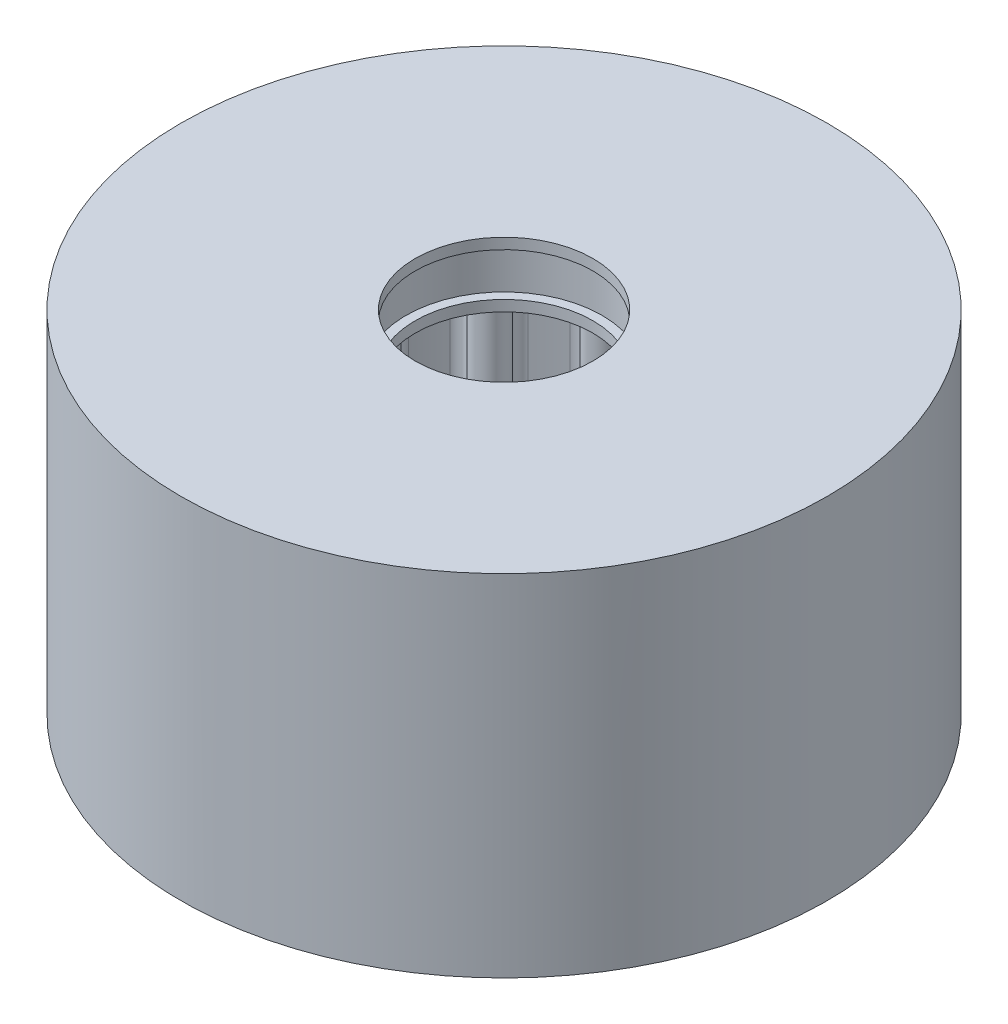
from build123d import *

# Parameters (mm, degrees)
BOSS_EXTRUDE1_DEPTH = 13.25
CIRPATTERN1_COUNT   = 21
BOSS_EXTRUDE2_START = 6
SKETCH2_R           = 30.000000000000004
SKETCH2_R_2         = 8.25
BOSS_EXTRUDE2_DEPTH = 6
SKETCH3_R           = 9.1
CUT_EXTRUDE1_DEPTH  = 2


with BuildPart() as part:
    # Sketch1 → Boss-Extrude1 (new, symmetric)
    with BuildSketch(Plane(origin=(0, 0, 0), x_dir=(1, 0, 0), z_dir=(0, 1, 0))):
        with BuildLine():
            Line((26.16885009996627, 3.9443195121787307), (29.664924786753858, 4.471267985285243))
            ThreePointArc((29.664924786753858, 4.471267985285243), (30.000000000000004, 0), (29.664924786753858, -4.471267985285243))
            Line((29.664924786753858, -4.471267985285243), (26.16885009996627, -3.9443195121787307))
            ThreePointArc((26.16885009996627, -3.9443195121787307), (26.26287582989929, -3.2600191888929), (26.339010606423663, -2.5734980558298943))
            ThreePointArc((26.339010606423663, -2.5734980558298943), (26.0363796494984, -1.7549610171289916), (25.206249999999997, -1.485752650174316))
            ThreePointArc((25.206249999999997, -1.485752650174316), (23.5, 2.18e-15), (25.20625, 1.485752650174316))
            ThreePointArc((25.20625, 1.485752650174316), (26.0363796494984, 1.7549610171289936), (26.339010606423663, 2.5734980558298957))
            ThreePointArc((26.339010606423663, 2.5734980558298957), (26.262875829899293, 3.2600191888929015), (26.16885009996627, 3.9443195121787307))
        make_face()
    extrude(amount=BOSS_EXTRUDE1_DEPTH, both=True)

    # CirPattern1: part ×21 about axis
    cirpattern1_axis = Axis((0, 3.3, 0), (0, -1, 0))


with BuildPart() as part_1:
    add(part.part)
    for i in range(1, CIRPATTERN1_COUNT):
        add(part.part.rotate(cirpattern1_axis, i * 360 / CIRPATTERN1_COUNT))

    # Sketch2 → Boss-Extrude2 (add)
    with BuildSketch(Plane(origin=(0, 13.25, 0), x_dir=(1, 0, 0), z_dir=(0, 1, 0)).offset(BOSS_EXTRUDE2_START)):
        Circle(SKETCH2_R)
        Circle(SKETCH2_R_2, mode=Mode.SUBTRACT)
    extrude(amount=-BOSS_EXTRUDE2_DEPTH)

    # Sketch3 → Cut-Extrude1 (cut, symmetric)
    with BuildSketch(Plane(origin=(0, 16.25, 0), x_dir=(-1, 0, 0), z_dir=(0, -1, 0))):
        Circle(SKETCH3_R)
    extrude(amount=CUT_EXTRUDE1_DEPTH, both=True, mode=Mode.SUBTRACT)


solid = part_1.part
